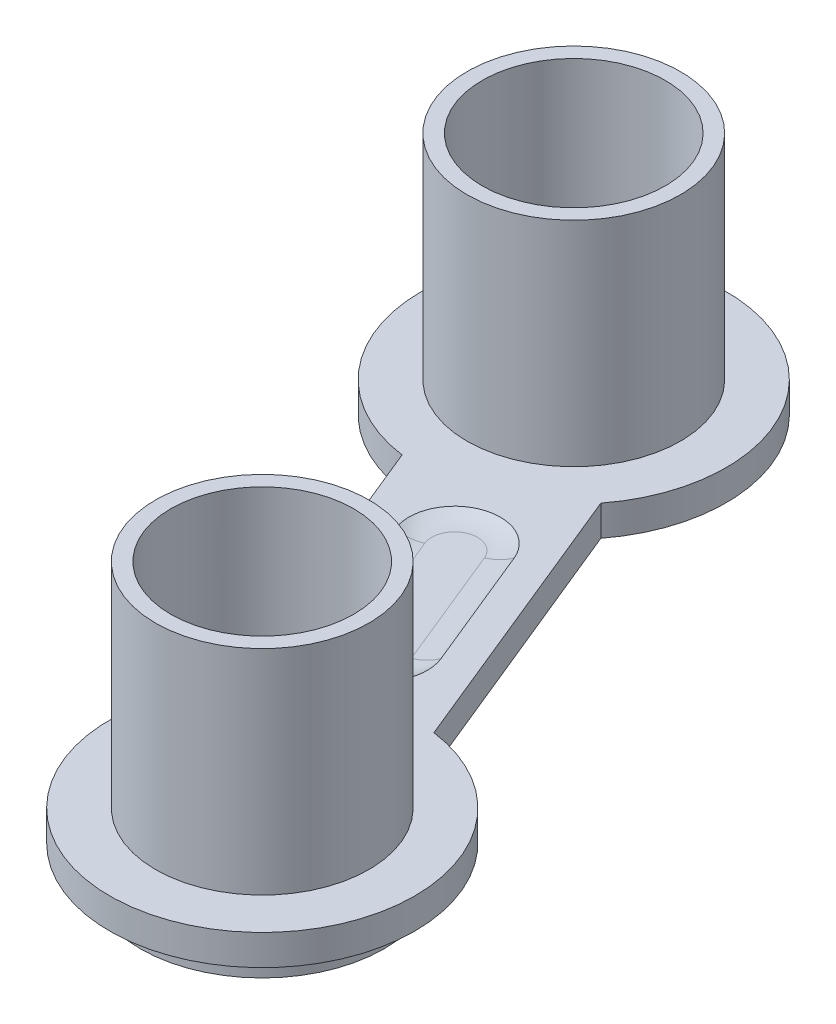
from build123d import *

# Parameters (mm, degrees)
CROQUIS1_R               = 3
SALIENTE_EXTRUIR1_DEPTH  = 1
CROQUIS2_R               = 3.5
CROQUIS2_R_2             = 3
SALIENTE_EXTRUIR2_DEPTH  = 7
SALIENTE_EXTRUIR3_START  = 1
CROQUIS3_R               = 4
CROQUIS3_R_2             = 3
SALIENTE_EXTRUIR3_DEPTH  = 1
CORTAR_EXTRUIR3_DEPTH    = 0.2
REDONDEO4_R              = 1.5
REDONDEO4_OF_SIMETR_A4_R = 1.5


with BuildPart() as part:
    # Croquis1 → Saliente-Extruir1 (new body)
    with BuildSketch(Plane(origin=(0, 0, 0), x_dir=(1, 0, 0), z_dir=(0, 1, 0))):
        with BuildLine():
            Line((-50.264827345, 5.804943896), (-54.04727716, 15.061999227))
            ThreePointArc((-54.04727716, 15.061999227), (-59.890614713, 22.75333698), (-58.675804825, 13.17077432))
            Line((-58.675804825, 13.17077432), (-54.893355011, 3.913718989))
            ThreePointArc((-54.893355011, 3.913718989), (-49.050017457, -3.777618763), (-50.264827345, 5.804943896))
        make_face()
        with Locations(Location((-57.999389806, 18.124809314, 0), (0, 0, 270))):
            Circle(CROQUIS1_R, mode=Mode.SUBTRACT)
        with Locations(Location((-50.941242364, 0.850908902, 0), (0, 0, 270))):
            Circle(CROQUIS1_R, mode=Mode.SUBTRACT)
    extrude(amount=SALIENTE_EXTRUIR1_DEPTH)

    # Croquis2 → Saliente-Extruir2 (add)
    # profile 1 of 2: a face of its own
    with BuildSketch(Plane(origin=(0, 1, 0), x_dir=(1, 0, 0), z_dir=(0, 1, 0))):
        with Locations(Location((-50.941242364, 0.850908902, 0), (0, 0, 270))):
            Circle(CROQUIS2_R)
        with Locations(Location((-50.941242364, 0.850908902, 0), (0, 0, 270))):
            Circle(CROQUIS2_R_2, mode=Mode.SUBTRACT)
    # profile 2 of 2: a face of its own
    with BuildSketch(Plane(origin=(0, 1, 0), x_dir=(1, 0, 0), z_dir=(0, 1, 0))):
        with Locations(Location((-57.999389806, 18.124809314, 0), (0, 0, 270))):
            Circle(CROQUIS2_R)
        with Locations(Location((-57.999389806, 18.124809314, 0), (0, 0, 270))):
            Circle(CROQUIS2_R_2, mode=Mode.SUBTRACT)
    extrude(amount=SALIENTE_EXTRUIR2_DEPTH)

    # Croquis3 → Saliente-Extruir3 (add)
    with BuildSketch(Plane.XZ.offset(SALIENTE_EXTRUIR3_START)):
        with Locations(Location((-50.941242364, -0.850908902, 0), (0, 0, 90))):
            Circle(CROQUIS3_R)
        with Locations(Location((-50.941242364, -0.850908902, 0), (0, 0, 270))):
            Circle(CROQUIS3_R_2, mode=Mode.SUBTRACT)
    extrude(amount=-SALIENTE_EXTRUIR3_DEPTH)

    # Croquis4 → Cortar-Extruir3 (cut)
    with BuildSketch(Plane.XZ):
        with BuildLine():
            Line((-55.03045688, -6.89304724), (-53.64189858, -7.460414712))
            Line((-53.64189858, -7.460414712), (-53.074531108, -6.071856412))
            ThreePointArc((-53.074531108, -6.071856412), (-54.222568183, -6.077366335), (-55.03045688, -6.89304724))
        make_face()
        with BuildLine():
            Line((-53.074531108, -6.071856412), (-53.64189858, -7.460414712))
            Line((-53.64189858, -7.460414712), (-52.253340281, -8.027782184))
            ThreePointArc((-52.253340281, -8.027782184), (-52.258850203, -6.879745109), (-53.074531108, -6.071856412))
        make_face()
        Polygon((-52.253340281, -8.027782184), (-53.64189858, -7.460414712), (-55.29873359, -11.515303505), (-53.91017529, -12.082670977), align=None)
        Polygon((-55.29873359, -11.515303505), (-53.64189858, -7.460414712), (-55.03045688, -6.89304724), (-56.68729189, -10.947936033), align=None)
        with BuildLine():
            Line((-53.91017529, -12.082670977), (-55.29873359, -11.515303505))
            Line((-55.29873359, -11.515303505), (-55.866101062, -12.903861804))
            ThreePointArc((-55.866101062, -12.903861804), (-54.718063987, -12.898351882), (-53.91017529, -12.082670977))
        make_face()
        with BuildLine():
            Line((-55.866101062, -12.903861804), (-55.29873359, -11.515303505))
            Line((-55.29873359, -11.515303505), (-56.68729189, -10.947936033))
            ThreePointArc((-56.68729189, -10.947936033), (-56.681781967, -12.095973108), (-55.866101062, -12.903861804))
        make_face()
    cortar_extruir3 = extrude(amount=-CORTAR_EXTRUIR3_DEPTH, mode=Mode.SUBTRACT)

    # Redondeo4
    # the kernel refuses this fillet: 1.5 mm, written as the material it adds along each edge
    with BuildSketch(Plane(origin=(-55.29873359, 0.2, -11.515303505), x_dir=(0.9257055331084191, 0, -0.3782449814240206), z_dir=(0.3782449814240206, 0, 0.9257055331084191))) as redondeo4_piece_1:
        with BuildLine():
            CenterArc((0.751668523, -1.5), REDONDEO4_R, 60.073565133, 29.926434867)
            Line((0.751668523, 0), (0.751668523, 0.03))
            Line((0.751668523, 0.03), (1.5, 0.03))
            Line((1.5, 0.03), (1.53, 0))
            ThreePointArc((1.53, 0), (1.53, -0.1), (1.51496663, -0.174))
            Line((1.51496663, -0.174), (1.5, -0.2))
        make_face()
    revolve(axis=Axis((-55.29873359, 0.2, -11.515303505), (0, 1, 0)), revolution_arc=180)
    with BuildSketch(Plane(origin=(-53.91017529, 0.2, -12.082670977), x_dir=(0, -1, 0), z_dir=(0.37824498142401725, 0, 0.9257055331084204)), Plane(origin=(-55.03045688, 0.2, -6.89304724), x_dir=(0, -1, 0), z_dir=(-0.3782449814240187, 0, -0.9257055331084199))) as redondeo4_piece_2:
        with BuildLine():
            CenterArc((1.5, -0.748331477), REDONDEO4_R, 150.073565133, 29.926434867)
            Line((0, -0.748331477), (-0.03, -0.748331477))
            Line((-0.03, -0.748331477), (-0.03, 0))
            Line((-0.03, 0), (0, 0.03))
            ThreePointArc((0, 0.03), (0.1, 0.03), (0.174, 0.01496663))
            Line((0.174, 0.01496663), (0.2, 0))
        make_face()
    extrude(amount=4.380322519)
    with BuildSketch(Plane(origin=(-53.64189858, 0.2, -7.460414712), x_dir=(0.9257055331084226, 0, -0.378244981424012), z_dir=(-0.378244981424012, 0, -0.9257055331084226))) as redondeo4_piece_3:
        with BuildLine():
            CenterArc((0.751668523, 1.5), REDONDEO4_R, 270, 29.926434867)
            Line((0.751668523, 0), (0.751668523, -0.03))
            Line((0.751668523, -0.03), (1.5, -0.03))
            Line((1.5, -0.03), (1.53, 0))
            ThreePointArc((1.53, 0), (1.53, 0.1), (1.51496663, 0.174))
            Line((1.51496663, 0.174), (1.5, 0.2))
        make_face()
    revolve(axis=Axis((-53.64189858, 0.2, -7.460414712), (0, -1, 0)), revolution_arc=180)

    # Simetría4: Cortar-Extruir3 across plane
    add(cortar_extruir3.mirror(Plane(origin=(0, 0.5, 0), x_dir=(0, 0, 1), z_dir=(0, -1, 0))), mode=Mode.SUBTRACT)

    # Redondeo4 of Simetría4
    # the kernel refuses this fillet: 1.5 mm, written as the material it adds along each edge
    with BuildSketch(Plane(origin=(-55.29873359, 0.8, -11.515303505), x_dir=(0.9257055331084191, 0, -0.3782449814240206), z_dir=(0.3782449814240206, 0, 0.9257055331084191))) as redondeo4_of_simetr_a4_piece_1:
        with BuildLine():
            CenterArc((0.751668523, 1.5), REDONDEO4_OF_SIMETR_A4_R, 270, 29.926434867)
            Line((0.751668523, 0), (0.751668523, -0.03))
            Line((0.751668523, -0.03), (1.5, -0.03))
            Line((1.5, -0.03), (1.53, 0))
            ThreePointArc((1.53, 0), (1.53, 0.1), (1.51496663, 0.174))
            Line((1.51496663, 0.174), (1.5, 0.2))
        make_face()
    revolve(axis=Axis((-55.29873359, 0.8, -11.515303505), (0, 1, 0)), revolution_arc=180)
    with BuildSketch(Plane(origin=(-53.91017529, 0.8, -12.082670977), x_dir=(0, 1, 0), z_dir=(0.37824498142401725, 0, 0.9257055331084204)), Plane(origin=(-55.03045688, 0.8, -6.89304724), x_dir=(0, 1, 0), z_dir=(-0.3782449814240187, 0, -0.9257055331084199))) as redondeo4_of_simetr_a4_piece_2:
        with BuildLine():
            CenterArc((1.5, 0.748331477), REDONDEO4_OF_SIMETR_A4_R, 180, 29.926434867)
            Line((0, 0.748331477), (-0.03, 0.748331477))
            Line((-0.03, 0.748331477), (-0.03, 0))
            Line((-0.03, 0), (0, -0.03))
            ThreePointArc((0, -0.03), (0.1, -0.03), (0.174, -0.01496663))
            Line((0.174, -0.01496663), (0.2, 0))
        make_face()
    extrude(amount=4.380322519)
    with BuildSketch(Plane(origin=(-53.64189858, 0.8, -7.460414712), x_dir=(0.9257055331084226, 0, -0.378244981424012), z_dir=(-0.378244981424012, 0, -0.9257055331084226))) as redondeo4_of_simetr_a4_piece_3:
        with BuildLine():
            CenterArc((0.751668523, -1.5), REDONDEO4_OF_SIMETR_A4_R, 60.073565133, 29.926434867)
            Line((0.751668523, 0), (0.751668523, 0.03))
            Line((0.751668523, 0.03), (1.5, 0.03))
            Line((1.5, 0.03), (1.53, 0))
            ThreePointArc((1.53, 0), (1.53, -0.1), (1.51496663, -0.174))
            Line((1.51496663, -0.174), (1.5, -0.2))
        make_face()
    revolve(axis=Axis((-53.64189858, 0.8, -7.460414712), (0, -1, 0)), revolution_arc=180)


solid = part.part
